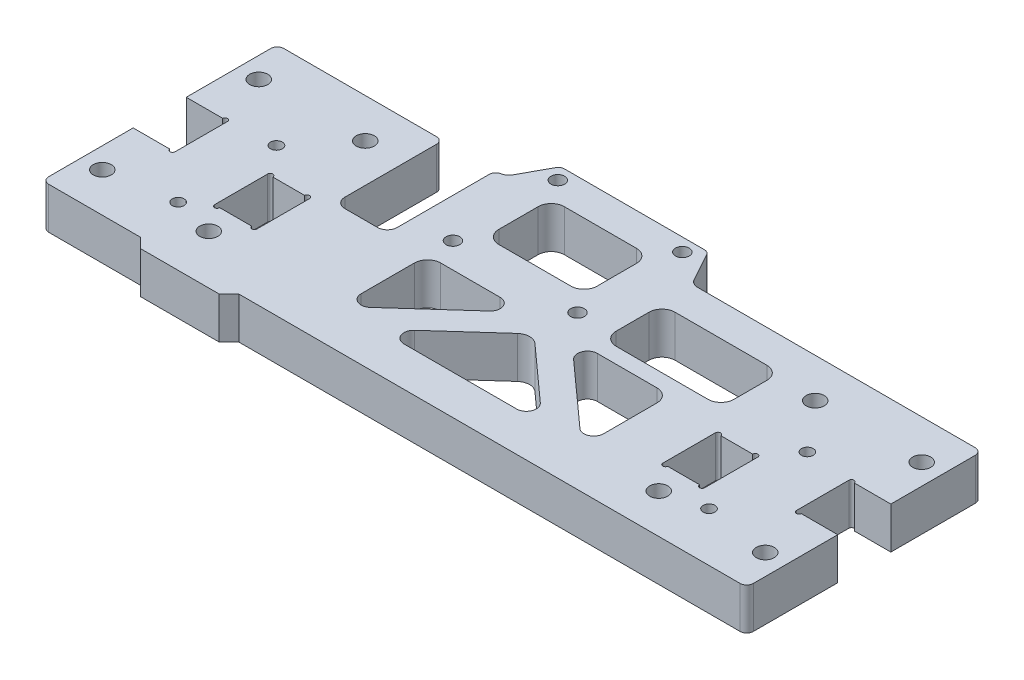
from build123d import *

# Parameters (mm, degrees)
SKETCH1_R           = 2.75
BOSS_EXTRUDE1_DEPTH = 12.7
SKETCH2_W           = 16
SKETCH2_H           = 46.496113018
CUT_EXTRUDE1_DEPTH  = 231.724624824
SKETCH3_R           = 2.1
CUT_EXTRUDE2_DEPTH  = 231.724624824
CUT_EXTRUDE3_DEPTH  = 231.724624824
FILLET1_R           = 3
FILLET2_R           = 2
SKETCH6_R           = 1.8
CUT_EXTRUDE4_DEPTH  = 231.724624958


with BuildPart() as part:
    # Sketch1 → Boss-Extrude1 (new body)
    with BuildSketch(Plane(origin=(0, 0, 0), x_dir=(1, 0, 0), z_dir=(0, 1, 0))):
        with BuildLine():
            Line((0, 71.75), (69.5, 71.75))
            Line((69.5, 71.75), (75.5, 82.75))
            Line((75.5, 82.75), (120.5, 82.75))
            Line((120.5, 82.75), (126.5, 71.75))
            Line((126.5, 71.75), (215, 71.75))
            Line((215, 71.75), (215, 43.975))
            Line((215, 43.975), (203.881088693, 43.975))
            ThreePointArc((203.881088693, 43.975), (203.090544346, 44.652363805), (202.3, 43.975))
            Line((202.3, 43.975), (202.3, 27.775))
            ThreePointArc((202.3, 27.775), (203.090544346, 27.097636195), (203.881088693, 27.775))
            Line((203.881088693, 27.775), (215, 27.775))
            Line((215, 27.775), (215, 0))
            Line((215, 0), (60, 0))
            Line((60, 0), (57, -3))
            Line((57, -3), (33, -3))
            Line((33, -3), (30, 0))
            Line((30, 0), (0, 0))
            Line((0, 0), (0, 27.775))
            Line((0, 27.775), (11.118911307, 27.775))
            ThreePointArc((11.118911307, 27.775), (11.909455654, 27.097636195), (12.7, 27.775))
            Line((12.7, 27.775), (12.7, 43.975))
            ThreePointArc((12.7, 43.975), (11.909455654, 44.652363805), (11.118911307, 43.975))
            Line((11.118911307, 43.975), (0, 43.975))
            Line((0, 43.975), (0, 71.75))
        make_face()
        with Locations((38.85, 59.75)):
            Circle(SKETCH1_R, mode=Mode.SUBTRACT)
        with Locations((38.85, 12)):
            Circle(SKETCH1_R, mode=Mode.SUBTRACT)
        with Locations((176.15, 59.75)):
            Circle(SKETCH1_R, mode=Mode.SUBTRACT)
        with Locations((176.15, 12)):
            Circle(SKETCH1_R, mode=Mode.SUBTRACT)
        with Locations((6.35, 12)):
            Circle(SKETCH1_R, mode=Mode.SUBTRACT)
        with Locations((6.35, 59.75)):
            Circle(SKETCH1_R, mode=Mode.SUBTRACT)
        with Locations((208.65, 59.75)):
            Circle(SKETCH1_R, mode=Mode.SUBTRACT)
        with Locations((208.65, 12)):
            Circle(SKETCH1_R, mode=Mode.SUBTRACT)
        with BuildLine():
            Line((32.700387603, 36.1), (32.700387603, 19.9))
            ThreePointArc((32.700387603, 19.9), (33.500387603, 19.1), (34.300387603, 19.9))
            Line((34.300387603, 19.9), (44.006274607, 19.9))
            ThreePointArc((44.006274607, 19.9), (44.85009833, 19.201570193), (45.6, 20))
            Line((45.6, 20), (45.6, 36))
            ThreePointArc((45.6, 36), (44.85009833, 36.798429807), (44.006274607, 36.1))
            Line((44.006274607, 36.1), (34.300387603, 36.1))
            ThreePointArc((34.300387603, 36.1), (33.500387603, 36.9), (32.700387603, 36.1))
        make_face(mode=Mode.SUBTRACT)
        with BuildLine():
            Line((182.299612397, 36.1), (182.299612397, 19.9))
            ThreePointArc((182.299612397, 19.9), (181.499612397, 19.1), (180.699612397, 19.9))
            Line((180.699612397, 19.9), (170.993725393, 19.9))
            ThreePointArc((170.993725393, 19.9), (170.14990167, 19.201570193), (169.4, 20))
            Line((169.4, 20), (169.4, 36))
            ThreePointArc((169.4, 36), (170.14990167, 36.798429807), (170.993725393, 36.1))
            Line((170.993725393, 36.1), (180.699612397, 36.1))
            ThreePointArc((180.699612397, 36.1), (181.499612397, 36.9), (182.299612397, 36.1))
        make_face(mode=Mode.SUBTRACT)
    extrude(amount=BOSS_EXTRUDE1_DEPTH)

    # Sketch2 → Cut-Extrude1 (cut, through all)
    with BuildSketch(Plane(origin=(0, 12.7, 0), x_dir=(1, 0, 0), z_dir=(0, 1, 0))):
        with Locations((58.6, 61.998056509)):
            Rectangle(SKETCH2_W, SKETCH2_H)
    extrude(amount=-CUT_EXTRUDE1_DEPTH, mode=Mode.SUBTRACT)

    # Sketch3 → Cut-Extrude2 (cut, through all)
    with BuildSketch(Plane(origin=(0, 12.7, 0), x_dir=(1, 0, 0), z_dir=(0, 1, 0))):
        with Locations((78.6, 78.75)):
            Circle(SKETCH3_R)
        with Locations((78.6, 46.75)):
            Circle(SKETCH3_R)
        with Locations((116.6, 78.75)):
            Circle(SKETCH3_R)
        with Locations((116.6, 46.75)):
            Circle(SKETCH3_R)
    extrude(amount=-CUT_EXTRUDE2_DEPTH, mode=Mode.SUBTRACT)

    # Sketch5 → Cut-Extrude3 (cut, through all)
    with BuildSketch(Plane(origin=(0, 12.7, 0), x_dir=(1, 0, 0), z_dir=(0, 1, 0))):
        with BuildLine():
            Line((83.606894195, 16.506204775), (102.789019513, 33.770117561))
            ThreePointArc((102.789019513, 33.770117561), (103.582986553, 37.074791302), (100.782125318, 39))
            Line((100.782125318, 39), (82.6, 39))
            ThreePointArc((82.6, 39), (79.771572875, 37.828427125), (78.6, 35))
            Line((78.6, 35), (78.6, 18.736087214))
            ThreePointArc((78.6, 18.736087214), (80.379484245, 15.995587024), (83.606894195, 16.506204775))
        make_face()
        with BuildLine():
            Line((112.924141074, 32.091726966), (96.410980487, 17.229882439))
            ThreePointArc((96.410980487, 17.229882439), (95.617013447, 13.925208698), (98.417874682, 12))
            Line((98.417874682, 12), (132.782125318, 12))
            ThreePointArc((132.782125318, 12), (135.582986553, 13.925208698), (134.789019513, 17.229882439))
            Line((134.789019513, 17.229882439), (118.275858926, 32.091726966))
            ThreePointArc((118.275858926, 32.091726966), (115.6, 33.118550381), (112.924141074, 32.091726966))
        make_face()
        with BuildLine():
            Line((130.417874682, 39), (148.6, 39))
            ThreePointArc((148.6, 39), (151.428427125, 37.828427125), (152.6, 35))
            Line((152.6, 35), (152.6, 18.736087214))
            ThreePointArc((152.6, 18.736087214), (150.820515755, 15.995587024), (147.593105805, 16.506204775))
            Line((147.593105805, 16.506204775), (128.410980487, 33.770117561))
            ThreePointArc((128.410980487, 33.770117561), (127.617013447, 37.074791302), (130.417874682, 39))
        make_face()
        with BuildLine():
            Line((86.6, 72.75), (108.6, 72.75))
            ThreePointArc((108.6, 72.75), (111.428427125, 71.578427125), (112.6, 68.75))
            Line((112.6, 68.75), (112.6, 56.75))
            ThreePointArc((112.6, 56.75), (111.428427125, 53.921572875), (108.6, 52.75))
            Line((108.6, 52.75), (86.6, 52.75))
            ThreePointArc((86.6, 52.75), (83.771572875, 53.921572875), (82.6, 56.75))
            Line((82.6, 56.75), (82.6, 68.75))
            ThreePointArc((82.6, 68.75), (83.771572875, 71.578427125), (86.6, 72.75))
        make_face()
        with BuildLine():
            Line((131.4, 61.75), (159.4, 61.75))
            ThreePointArc((159.4, 61.75), (162.228427125, 60.578427125), (163.4, 57.75))
            Line((163.4, 57.75), (163.4, 47.75))
            ThreePointArc((163.4, 47.75), (162.228427125, 44.921572875), (159.4, 43.75))
            Line((159.4, 43.75), (131.4, 43.75))
            ThreePointArc((131.4, 43.75), (128.571572875, 44.921572875), (127.4, 47.75))
            Line((127.4, 47.75), (127.4, 57.75))
            ThreePointArc((127.4, 57.75), (128.571572875, 60.578427125), (131.4, 61.75))
        make_face()
    extrude(amount=-CUT_EXTRUDE3_DEPTH, mode=Mode.SUBTRACT)

    # Fillet1
    fillet1_edges = [part.edges().sort_by_distance(p)[0] for p in [
        (69.5, 6.35, -71.75),
        (66.6, 6.35, -38.75),
        (50.6, 6.35, -38.75),
        (126.5, 6.35, -71.75),
    ]]
    fillet(fillet1_edges, radius=FILLET1_R)

    # Fillet2
    fillet2_edges = [part.edges().sort_by_distance(p)[0] for p in [
        (215, 6.35, -71.75),
        (120.5, 6.35, -82.75),
        (75.5, 6.35, -82.75),
        (50.6, 6.35, -71.75),
        (66.6, 6.35, -71.75),
        (0, 6.35, -71.75),
        (215, 6.35, 0),
        (0, 6.35, 0),
    ]]
    fillet(fillet2_edges, radius=FILLET2_R)

    # Sketch6 → Cut-Extrude4 (cut, through all)
    with BuildSketch(Plane(origin=(0, 12.7, 0), x_dir=(1, 0, 0), z_dir=(0, 1, 0))):
        with Locations((188.5, 45)):
            Circle(SKETCH6_R)
        with Locations((188.5, 15)):
            Circle(SKETCH6_R)
        with Locations((26.5, 45)):
            Circle(SKETCH6_R)
        with Locations((26.5, 15)):
            Circle(SKETCH6_R)
    extrude(amount=-CUT_EXTRUDE4_DEPTH, mode=Mode.SUBTRACT)


solid = part.part
